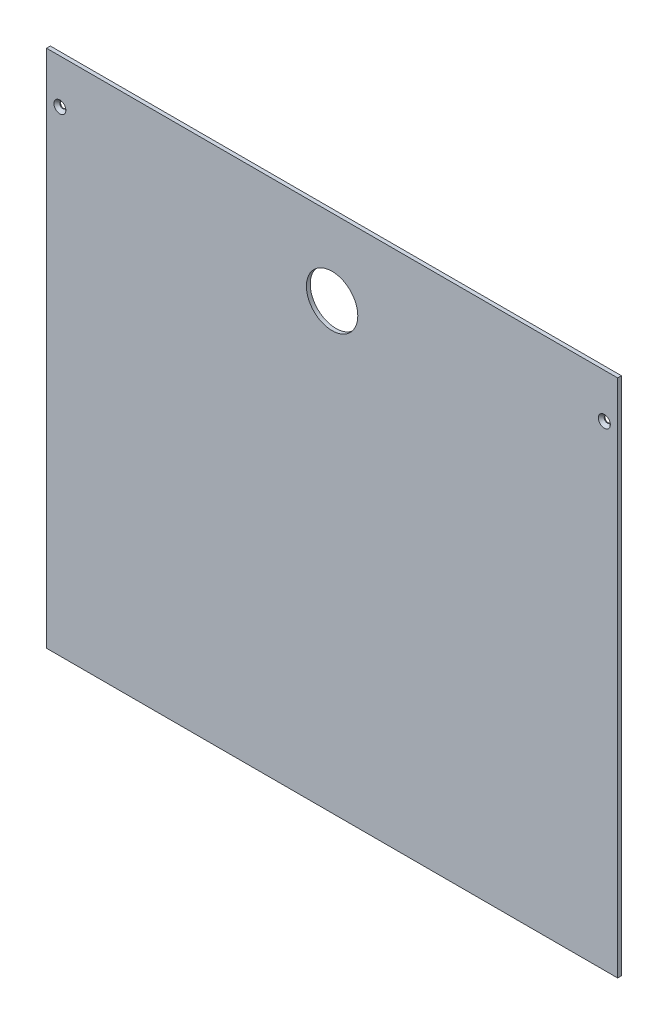
from build123d import *

# Parameters (mm, degrees)
SKETCH1_W             = 300
SKETCH1_H             = 273
BASE_FLANGE1_DEPTH    = 2
M25_CLEARANCE_HOLE1_D = 27


# Sheet-metal steps are written as plain solids
with BuildPart() as part:
    # Sketch1 → Base-Flange1 (new body)
    with BuildSketch(Plane.XY):
        with Locations((-150, 136.5)):
            Rectangle(SKETCH1_W, SKETCH1_H)
    extrude(amount=-BASE_FLANGE1_DEPTH)

    # Sketch8 → CSK for M3 Oval Head Machine Screw1 (revolve, cut)
    with BuildSketch(Plane(origin=(-293, 249.78, 0), x_dir=(0, -1, 0), z_dir=(1, 0, 0))):
        Polygon((0, 0), (0, 2), (1.6, 2), (1.6, 1.55), (3.15, 0), align=None)
    csk_for_m3_oval_head_machine_screw1 = revolve(axis=Axis((-293, 249.78, 6.35), (0, 0, -1)), mode=Mode.SUBTRACT)

    # Mirror1: CSK for M3 Oval Head Machine Screw1 across plane
    add(csk_for_m3_oval_head_machine_screw1.mirror(Plane.ZY.offset(150)), mode=Mode.SUBTRACT)

    # M25 Clearance Hole1 (through all)
    with Locations(Plane.XY):
        with Locations((-150, 233)):
            Hole(M25_CLEARANCE_HOLE1_D / 2)


solid = part.part
